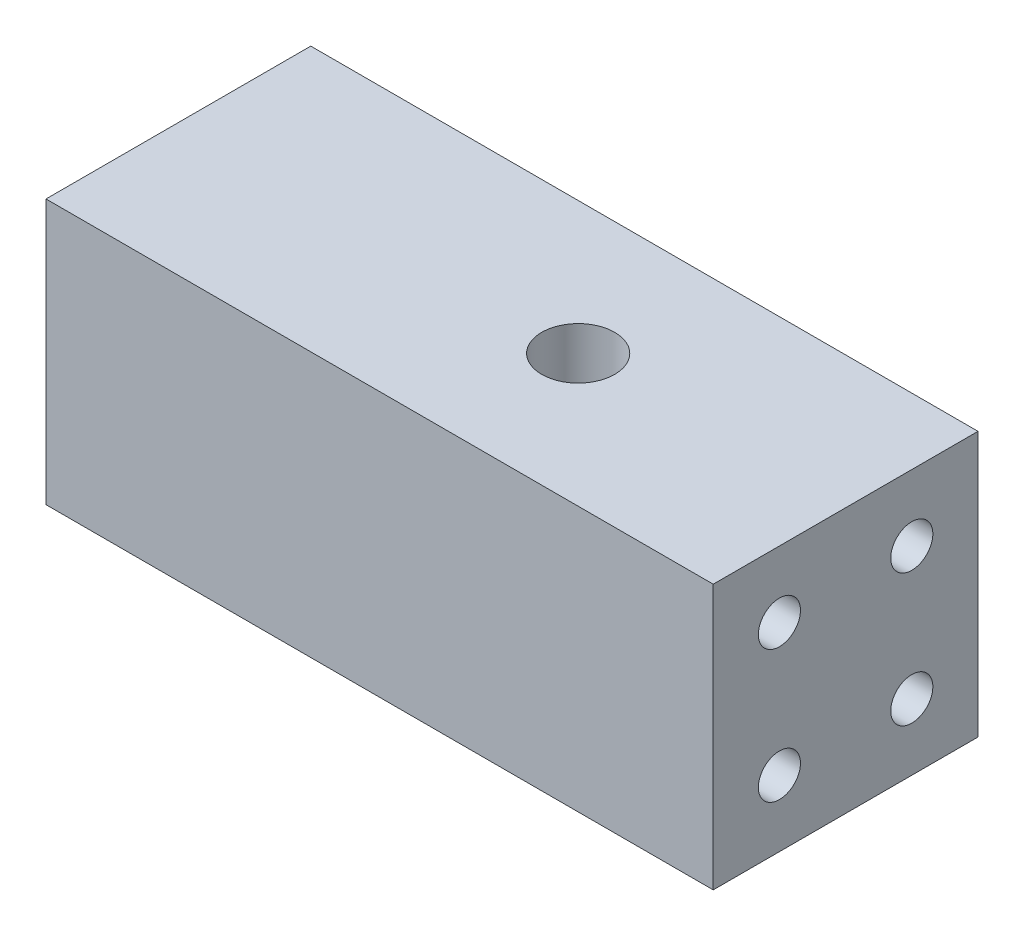
from build123d import *

# Parameters (mm, degrees)
SKETCH1_W                  = 64.008
SKETCH1_H                  = 25.4
BOSS_EXTRUDE1_DEPTH        = 25.4
F_10_32_TAPPED_HOLE1_D     = 4.0386
F_10_32_TAPPED_HOLE1_DEPTH = 8.636
F_10_32_TAPPED_HOLE1_TIP   = 1.213317848
F_10_32_TAPPED_HOLE2_D     = 4.0386
F_10_32_TAPPED_HOLE2_DEPTH = 8.636
F_10_32_TAPPED_HOLE2_TIP   = 1.213317848
F_6_0MM_DOWEL_HOLE1_D      = 7


with BuildPart() as part:
    # Sketch1 → Boss-Extrude1 (new body)
    with BuildSketch(Plane(origin=(0, 0, 0), x_dir=(1, 0, 0), z_dir=(0, 1, 0))):
        with Locations((32.004, 12.7)):
            Rectangle(SKETCH1_W, SKETCH1_H)
    extrude(amount=BOSS_EXTRUDE1_DEPTH)

    # #10-32 Tapped Hole1
    with Locations(Plane(origin=(64.008, 0, 0), x_dir=(0, 0, -1), z_dir=(1, 0, 0))):
        with Locations((6.35, 19.05), (19.05, 19.05), (19.05, 6.35), (6.35, 6.35)):
            Hole(F_10_32_TAPPED_HOLE1_D / 2, depth=F_10_32_TAPPED_HOLE1_DEPTH)
            with Locations((0, 0, -(F_10_32_TAPPED_HOLE1_DEPTH + F_10_32_TAPPED_HOLE1_TIP / 2))):  # 118° drill point
                Cone(0, F_10_32_TAPPED_HOLE1_D / 2, F_10_32_TAPPED_HOLE1_TIP, mode=Mode.SUBTRACT)

    # #10-32 Tapped Hole2
    with Locations(Plane.ZY):
        with Locations((-19.05, 19.05), (-6.35, 19.05), (-6.35, 6.35), (-19.05, 6.35)):
            Hole(F_10_32_TAPPED_HOLE2_D / 2, depth=F_10_32_TAPPED_HOLE2_DEPTH)
            with Locations((0, 0, -(F_10_32_TAPPED_HOLE2_DEPTH + F_10_32_TAPPED_HOLE2_TIP / 2))):  # 118° drill point
                Cone(0, F_10_32_TAPPED_HOLE2_D / 2, F_10_32_TAPPED_HOLE2_TIP, mode=Mode.SUBTRACT)

    # Ø6.0mm Dowel Hole1 (through all)
    with Locations(Plane(origin=(0, 25.4, 0), x_dir=(1, 0, 0), z_dir=(0, 1, 0))):
        with Locations((38.354, 12.7)):
            Hole(F_6_0MM_DOWEL_HOLE1_D / 2)


solid = part.part
